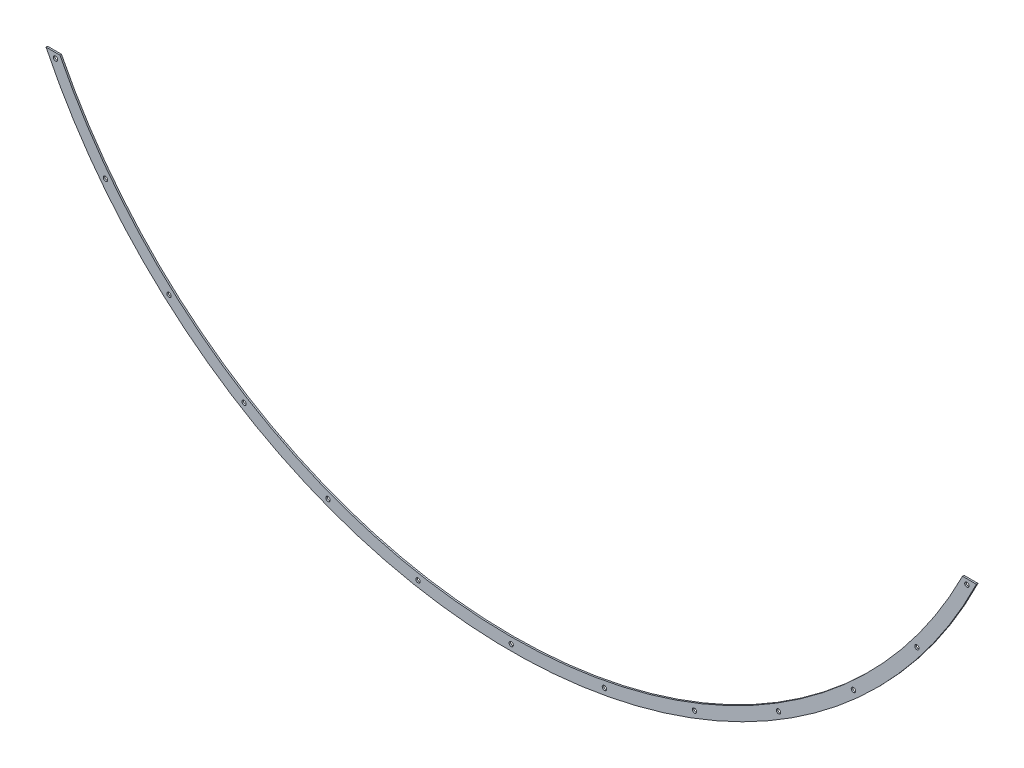
from build123d import *

# Parameters (mm, degrees)
BASE_FLANGE1_DEPTH              = 2.5
SKETCH2_W                       = 1968.518691842
SKETCH2_H                       = 782.123286761
CUT_EXTRUDE1_DEPTH              = 10
CUT_EXTRUDE3_DEPTH              = 10
SKETCH10_R                      = 3.5
CUT_EXTRUDE4_DEPTH              = 10
CIRPATTERN1_COUNT               = 10
CIRPATTERN1_ANGLE               = 94.5
CIRPATTERN1_THE_OTHER_WAY_COUNT = 10
CIRPATTERN1_THE_OTHER_WAY_ANGLE = 94.5


# Sheet-metal steps are written as plain solids
with BuildPart() as part:
    # Sketch1 → Base-Flange1 (new body)
    with BuildSketch(Plane.XY):
        with BuildLine():
            Line((829.984939622, -5), (-829.984939622, -5))
            ThreePointArc((-829.984939622, -5), (0, -830), (829.984939622, -5))
        make_face()
    extrude(amount=-BASE_FLANGE1_DEPTH)

    # Sketch2 → Cut-Extrude1 (cut)
    with BuildSketch(Plane.XY):
        with Locations((10.387961435, 27.061643381)):
            Rectangle(SKETCH2_W, SKETCH2_H)
    extrude(amount=-CUT_EXTRUDE1_DEPTH, mode=Mode.SUBTRACT)

    # Sketch9 → Cut-Extrude3 (cut)
    with BuildSketch(Plane.XY):
        with BuildLine():
            Line((-723.60486455, -364), (723.60486455, -364))
            ThreePointArc((723.60486455, -364), (0, -810), (-723.60486455, -364))
        make_face()
    extrude(amount=-CUT_EXTRUDE3_DEPTH, mode=Mode.SUBTRACT)

    # Sketch10 → Cut-Extrude4 (cut)
    with BuildSketch(Plane(origin=(0, 0, -2.5), x_dir=(-1, 0, 0), z_dir=(0, 0, -1))):
        with Locations((0, -820)):
            Circle(SKETCH10_R)
    cut_extrude4 = extrude(amount=-CUT_EXTRUDE4_DEPTH, mode=Mode.SUBTRACT)

    # CirPattern1: Cut-Extrude4 ×10 about axis
    cirpattern1_axis = Axis((0, 0, 0), (0, 0, 1))
    for i in range(1, CIRPATTERN1_COUNT):
        add(cut_extrude4.rotate(cirpattern1_axis, i * CIRPATTERN1_ANGLE / (CIRPATTERN1_COUNT - 1)), mode=Mode.SUBTRACT)

    # CirPattern1 the other way: Cut-Extrude4 ×10 about axis
    cirpattern1_the_other_way_axis = Axis((0, 0, 0), (0, 0, -1))
    for i in range(1, CIRPATTERN1_THE_OTHER_WAY_COUNT):
        add(cut_extrude4.rotate(cirpattern1_the_other_way_axis, i * CIRPATTERN1_THE_OTHER_WAY_ANGLE / (CIRPATTERN1_THE_OTHER_WAY_COUNT - 1)), mode=Mode.SUBTRACT)


solid = part.part
